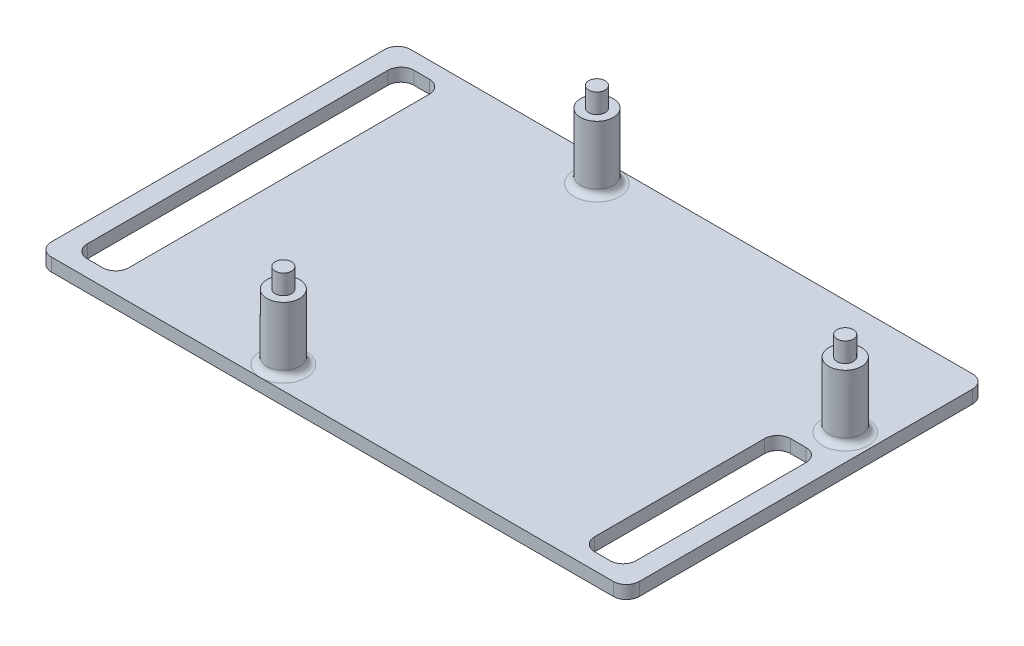
from build123d import *

# Parameters (mm, degrees)
SKETCH1_W           = 90
SKETCH1_H           = 55
SKETCH1_W_2         = 6.35
SKETCH1_H_2         = 30
SKETCH1_H_3         = 50
BOSS_EXTRUDE1_DEPTH = 2
SKETCH2_R           = 2.5
BOSS_EXTRUDE2_DEPTH = 10
SKETCH3_R           = 1.25
BOSS_EXTRUDE3_DEPTH = 3
FILLET1_R           = 2
FILLET2_R           = 1


with BuildPart() as part:
    # Sketch1 → Boss-Extrude1 (new body)
    with BuildSketch(Plane(origin=(0, 0, 0), x_dir=(1, 0, 0), z_dir=(0, 1, 0))):
        with Locations((45, 27.5)):
            Rectangle(SKETCH1_W, SKETCH1_H)
        with Locations((83.825, 17.5)):
            Rectangle(SKETCH1_W_2, SKETCH1_H_2, mode=Mode.SUBTRACT)
        with Locations((6.175, 27.5)):
            Rectangle(SKETCH1_W_2, SKETCH1_H_3, mode=Mode.SUBTRACT)
    extrude(amount=BOSS_EXTRUDE1_DEPTH)

    # Sketch2 → Boss-Extrude2 (add)
    with BuildSketch(Plane(origin=(0, 2, 0), x_dir=(1, 0, 0), z_dir=(0, 1, 0))):
        with Locations(Location((34, 51.5, 0), (0, 0, 90))):
            Circle(SKETCH2_R)
        with Locations(Location((34, 3.5, 0), (0, 0, 90))):
            Circle(SKETCH2_R)
        with Locations(Location((86, 37.5, 0), (0, 0, 90))):
            Circle(SKETCH2_R)
    extrude(amount=BOSS_EXTRUDE2_DEPTH)

    # Sketch3 → Boss-Extrude3 (add)
    with BuildSketch(Plane(origin=(0, 12, 0), x_dir=(1, 0, 0), z_dir=(0, 1, 0))):
        with Locations(Location((34, 51.5, 0), (0, 0, 270))):
            Circle(SKETCH3_R)
        with Locations(Location((34, 3.5, 0), (0, 0, 270))):
            Circle(SKETCH3_R)
        with Locations(Location((86, 37.5, 0), (0, 0, 270))):
            Circle(SKETCH3_R)
    extrude(amount=BOSS_EXTRUDE3_DEPTH)

    # Fillet1
    fillet1_edges = [part.edges().sort_by_distance(p)[0] for p in [
        (80.65, 1, -32.5),
        (80.65, 1, -2.5),
        (87, 1, -2.5),
        (87, 1, -32.5),
        (3, 1, -52.5),
        (3, 1, -2.5),
        (9.35, 1, -2.5),
        (9.35, 1, -52.5),
        (0, 1, -55),
        (90, 1, -55),
        (90, 1, 0),
        (0, 1, 0),
    ]]
    fillet(fillet1_edges, radius=FILLET1_R)

    # Fillet2
    fillet2_edges = [part.edges().sort_by_distance(p)[0] for p in [
        (86, 2, -35),
        (34, 2, -1),
        (34, 2, -49),
    ]]
    fillet(fillet2_edges, radius=FILLET2_R - 0.0001)  # a hair under: the kernel refuses the full size


solid = part.part
